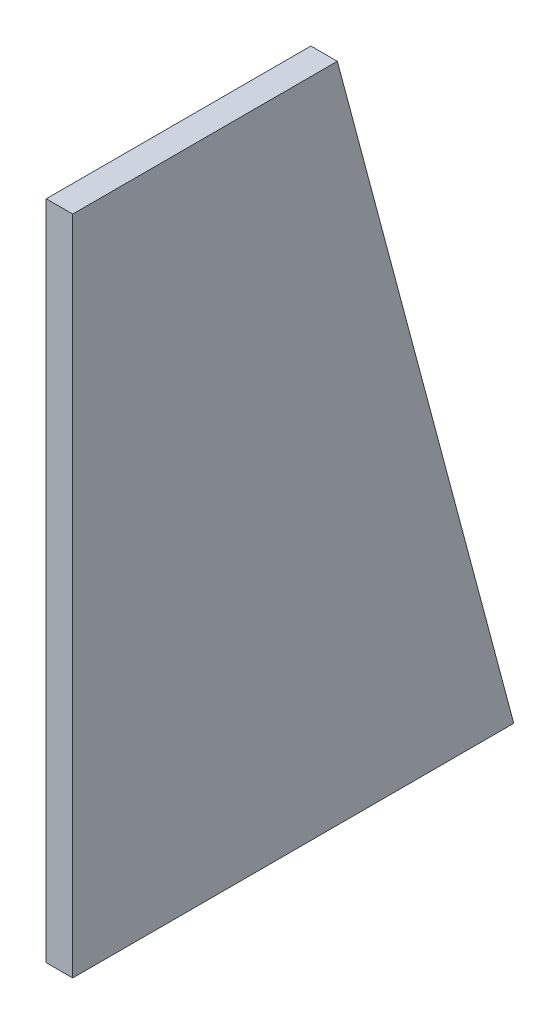
from build123d import *

# Parameters (mm, degrees)
EXTRUDE_1_DEPTH = 6


with BuildPart() as part:
    # Эскиз1 → Бобышка-Вытянуть1 (new body)
    with BuildSketch(Plane(origin=(0, 0, 0), x_dir=(0, 0, -1), z_dir=(1, 0, 0))):
        Polygon((0, 0), (100, 0), (60, 150), (0, 150), align=None)
    extrude(amount=EXTRUDE_1_DEPTH)


solid = part.part
